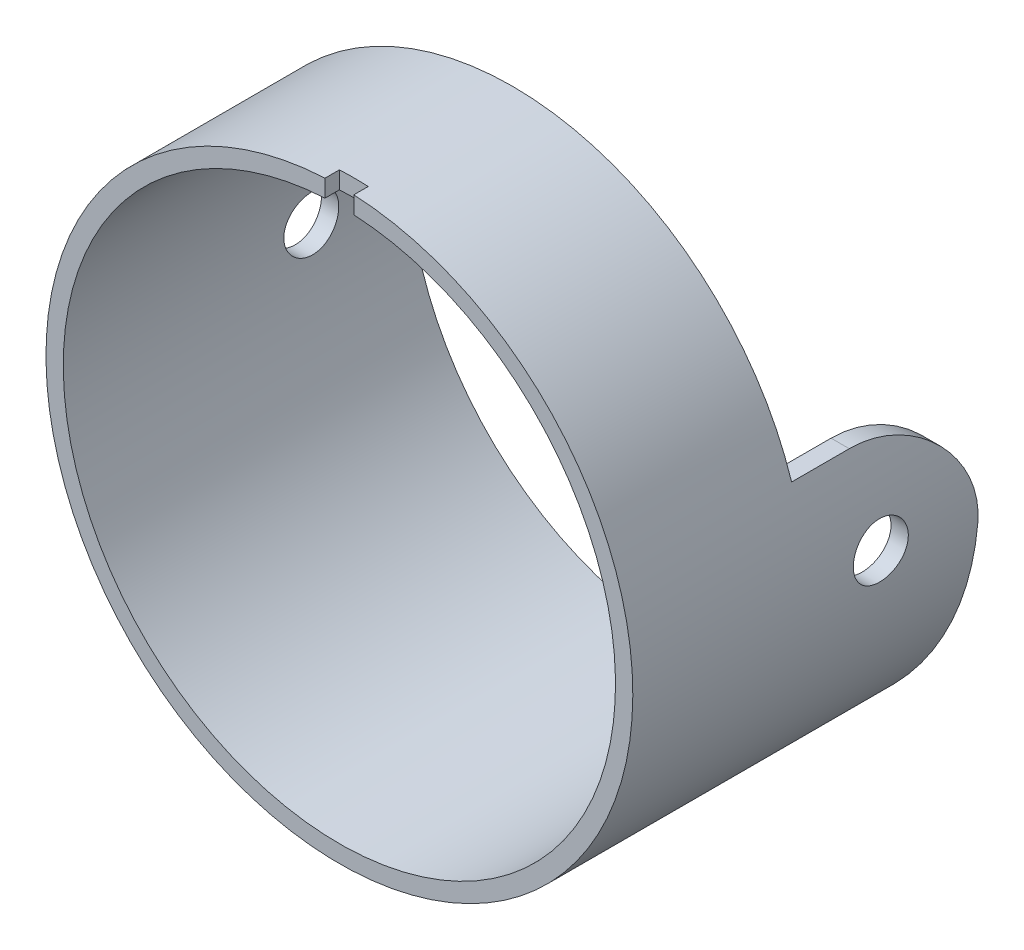
from build123d import *

# Parameters (mm, degrees)
SKETCH2_R               = 50.875
SKETCH2_R_2             = 47.875
BOSS_EXTRUDE1_DEPTH     = 60
CUT_EXTRUDE2_DEPTH      = 60
CUT_EXTRUDE2_DEPTH_BACK = 60
SKETCH3_OUTSIDE_W       = 93.18
SKETCH3_OUTSIDE_H       = 134.93
CUT_EXTRUDE3_DEPTH      = 94.683142827
CUT_EXTRUDE3_DEPTH_BACK = 94.683142827
SKETCH4_R               = 4.765
FILLET1_R               = 20
SKETCH5_W               = 5
SKETCH5_H               = 5
CUT_EXTRUDE4_DEPTH      = 60


with BuildPart() as part:
    # Sketch2 → Boss-Extrude1 (new body)
    with BuildSketch(Plane.XY):
        with Locations(Location((0, 0, 0), (0, 0, 180))):
            Circle(SKETCH2_R)
        with Locations(Location((0, 0, 0), (0, 0, 180))):
            Circle(SKETCH2_R_2, mode=Mode.SUBTRACT)
    extrude(amount=BOSS_EXTRUDE1_DEPTH)

    # Sketch3 outside → Cut-Extrude2 (cut, two sides: drawn at the far end of the back side and taken through both)
    with BuildSketch(Plane(origin=(0, 0, 0), x_dir=(0, 0, -1), z_dir=(1, 0, 0)).offset(-CUT_EXTRUDE2_DEPTH_BACK)):
        with Locations((-30, 0)):
            Rectangle(SKETCH3_OUTSIDE_W, SKETCH3_OUTSIDE_H)
        Polygon((-60, 50.875), (-60, -50.875), (0, -50.875), (0, 15.646937383), (-30, 15.646937383), (-30, 50.875), align=None, mode=Mode.SUBTRACT)
    extrude(amount=CUT_EXTRUDE2_DEPTH + CUT_EXTRUDE2_DEPTH_BACK, mode=Mode.SUBTRACT)

    # Sketch4 → Cut-Extrude3 (cut, two sides: drawn at the far end of the back side and taken through both)
    with BuildSketch(Plane(origin=(0, 0, 0), x_dir=(0, 0, -1), z_dir=(1, 0, 0)).offset(-CUT_EXTRUDE3_DEPTH_BACK)):
        with Locations((-17, 0)):
            Circle(SKETCH4_R)
    extrude(amount=CUT_EXTRUDE3_DEPTH + CUT_EXTRUDE3_DEPTH_BACK, mode=Mode.SUBTRACT)

    # Fillet1
    # the kernel refuses this fillet: 20 mm, written as the material it takes off along each edge
    with BuildSketch(Plane(origin=(-4.75412753, 15.646937383, 0), x_dir=(0, -1, 0), z_dir=(1, 0, 0)), Plane(origin=(-98.409079474, 15.646937383, 0), x_dir=(0, -1, 0), z_dir=(1, 0, 0))) as fillet1_piece_1:
        with BuildLine():
            CenterArc((FILLET1_R, -FILLET1_R), FILLET1_R, 90, 90)
            Line((0, -FILLET1_R), (0, 0))
            Line((0, 0), (FILLET1_R, 0))
        make_face()
    extrude(amount=103.163207005, mode=Mode.SUBTRACT)

    # Sketch5 → Cut-Extrude4 (cut)
    with BuildSketch(Plane(origin=(0, 0, 0), x_dir=(1, 0, 0), z_dir=(0, 1, 0))):
        with Locations((0, -60)):
            Rectangle(SKETCH5_W, SKETCH5_H)
    extrude(amount=CUT_EXTRUDE4_DEPTH, mode=Mode.SUBTRACT)


solid = part.part
